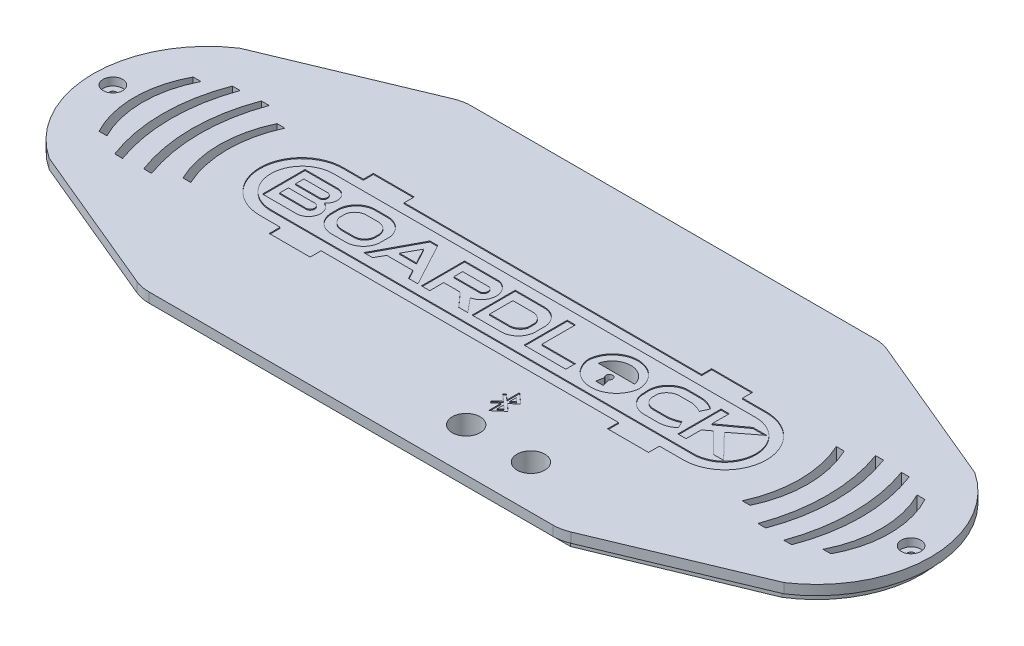
from build123d import *

# Parameters (mm, degrees)
BOSS_EXTRUDE3_DEPTH = 2.5
SKETCH2_8_R         = 3.55
BOSS_EXTRUDE4_DEPTH = 2.5
LOGO_DEPTH          = 0.25
FILLET1_R           = 10
SOUNDGAPS_REACH     = 178.856
BUTTONS_REACH       = 178.856
SKETCH5_R           = 3.55
CUT_EXTRUDE5_REACH  = 178.856
SKETCH9_R           = 2.5
CUT_EXTRUDE6_DEPTH  = 2
CUT_EXTRUDE7_REACH  = 178.856
SKETCH9_4_R         = 0.9
CUT_EXTRUDE8_DEPTH  = 0.25


with BuildPart() as part:
    # Sketch2 → Boss-Extrude3 (new body)
    with BuildSketch(Plane(origin=(0, 0, 0), x_dir=(1, 0, 0), z_dir=(0, 1, 0))):
        with BuildLine():
            Line((-2.5, 2.5), (104.5, 2.5))
            Line((104.5, 2.5), (144.737244829, -14.291091061))
            ThreePointArc((144.737244829, -14.291091061), (157.8, -38.6), (144.737244829, -62.908908939))
            Line((144.737244829, -62.908908939), (104.5, -79.7))
            Line((104.5, -79.7), (-2.5, -79.7))
            Line((-2.5, -79.7), (-42.737244829, -62.908908939))
            ThreePointArc((-42.737244829, -62.908908939), (-55.8, -38.6), (-42.737244829, -14.291091061))
            Line((-42.737244829, -14.291091061), (-2.5, 2.5))
        make_face()
    extrude(amount=BOSS_EXTRUDE3_DEPTH)

    # Sketch2<8> → Boss-Extrude4 (add)
    with BuildSketch(Plane(origin=(0, 0, 0), x_dir=(1, 0, 0), z_dir=(0, 1, 0))):
        with BuildLine():
            Line((102, 0), (0, 0))
            Line((0, 0), (-2.5, 0))
            Line((-2.5, 0), (-40.702591635, -15.743739118))
            ThreePointArc((-40.702591635, -15.743739118), (-53.480653983, -38.6), (-40.702591635, -61.456260882))
            Line((-40.702591635, -61.456260882), (-2.5, -77.2))
            Line((-2.5, -77.2), (0, -77.2))
            Line((0, -77.2), (102, -77.2))
            Line((102, -77.2), (104.5, -77.2))
            Line((104.5, -77.2), (142.702591635, -61.456260882))
            ThreePointArc((142.702591635, -61.456260882), (155.480653983, -38.6), (142.702591635, -15.743739118))
            Line((142.702591635, -15.743739118), (104.5, 0))
            Line((104.5, 0), (102, 0))
        make_face()
        with Locations((69.32, -68.6)):
            Circle(SKETCH2_8_R, mode=Mode.SUBTRACT)
        with Locations((85.83, -68.6)):
            Circle(SKETCH2_8_R, mode=Mode.SUBTRACT)
    extrude(amount=-BOSS_EXTRUDE4_DEPTH)

    # Sketch3 → Logo (cut)
    # profile 1 of 10: a face of its own
    with BuildSketch(Plane(origin=(0, 2.5, 0), x_dir=(1, 0, 0), z_dir=(0, 1, 0))):
        with BuildLine():
            Line((1.949493887, -27.461955416), (-2.987330566, -27.461955416))
            ThreePointArc((-2.987330566, -27.461955416), (-13.803120325, -38.068295938), (-2.987330566, -48.674636459))
            Line((-2.987330566, -48.674636459), (1.949493887, -48.674636459))
            Line((1.949493887, -48.674636459), (1.949493887, -51.464582861))
            Line((1.949493887, -51.464582861), (12.371678844, -51.464582861))
            Line((12.371678844, -51.464582861), (12.371678844, -48.674636459))
            Line((12.371678844, -48.674636459), (88.239814758, -48.674636459))
            Line((88.239814758, -48.674636459), (88.239814758, -51.464582861))
            Line((88.239814758, -51.464582861), (98.688646078, -51.464582861))
            Line((98.688646078, -51.464582861), (98.688646078, -48.674636459))
            Line((98.688646078, -48.674636459), (104.624475689, -48.674636459))
            ThreePointArc((104.624475689, -48.674636459), (115.383426883, -38.068295938), (104.624475689, -27.461955416))
            Line((104.624475689, -27.461955416), (98.688646078, -27.461955416))
            Line((98.688646078, -27.461955416), (98.688646078, -24.902120515))
            Line((98.688646078, -24.902120515), (88.239814758, -24.902120515))
            Line((88.239814758, -24.902120515), (88.239814758, -27.461955416))
            Line((88.239814758, -27.461955416), (12.371678844, -27.461955416))
            Line((12.371678844, -27.461955416), (12.371678844, -24.902120515))
            Line((12.371678844, -24.902120515), (1.949493887, -24.902120515))
            Line((1.949493887, -24.902120515), (1.949493887, -27.461955416))
        make_face()
        with BuildLine():
            ThreePointArc((-3.194751797, -46.01575407), (-11.064312283, -37.938772353), (-2.987330566, -30.069211866))
            Line((-2.987330566, -30.069211866), (104.700239847, -30.069211866))
            ThreePointArc((104.700239847, -30.069211866), (112.673510949, -38.042482968), (104.700239847, -46.01575407))
            Line((104.700239847, -46.01575407), (-3.194751797, -46.01575407))
        make_face(mode=Mode.SUBTRACT)
    # profile 2 of 10: a face of its own
    with BuildSketch(Plane(origin=(0, 2.5, 0), x_dir=(1, 0, 0), z_dir=(0, 1, 0))):
        with BuildLine():
            Line((0.713326147, -32.762452382), (-7.630609586, -32.762452382))
            Line((-7.630609586, -32.762452382), (-7.630609586, -43.623173078))
            Line((-7.630609586, -43.623173078), (1.144127176, -43.623173078))
            ThreePointArc((1.144127176, -43.623173078), (4.072531045, -41.089719603), (2.23246662, -37.682653616))
            ThreePointArc((2.23246662, -37.682653616), (3.210405226, -34.686087135), (0.713326147, -32.762452382))
        make_face()
        with BuildLine():
            Line((-5.680668083, -41.17440933), (-5.680668083, -38.952382967))
            Line((-5.680668083, -38.952382967), (0.713326147, -38.952382967))
            ThreePointArc((0.713326147, -38.952382967), (2.127219592, -40.063396149), (0.713326147, -41.17440933))
            Line((0.713326147, -41.17440933), (-5.680668083, -41.17440933))
        make_face(mode=Mode.SUBTRACT)
        with BuildLine():
            Line((-5.680668083, -37.138483894), (-5.680668083, -35.007152484))
            Line((-5.680668083, -35.007152484), (0.600049584, -35.007152484))
            ThreePointArc((0.600049584, -35.007152484), (1.408506175, -36.072818189), (0.600049584, -37.138483894))
            Line((0.600049584, -37.138483894), (-5.680668083, -37.138483894))
        make_face(mode=Mode.SUBTRACT)
    # profile 3 of 10: a face of its own
    with BuildSketch(Plane(origin=(0, 2.5, 0), x_dir=(1, 0, 0), z_dir=(0, 1, 0))):
        with BuildLine():
            Line((5.346460441, -36.917426319), (5.346460441, -39.213930644))
            ThreePointArc((5.346460441, -39.213930644), (6.885943052, -42.434479638), (10.251793679, -43.623173078))
            Line((10.251793679, -43.623173078), (13.828264636, -43.623173078))
            ThreePointArc((13.828264636, -43.623173078), (16.716995574, -42.386317426), (18.096652452, -39.562999301))
            Line((18.096652452, -39.562999301), (18.096652452, -36.788822077))
            ThreePointArc((18.096652452, -36.788822077), (16.446939465, -33.787674903), (13.228063284, -32.618370223))
            Line((13.228063284, -32.618370223), (9.865980952, -32.618370223))
            ThreePointArc((9.865980952, -32.618370223), (6.816585637, -33.937769105), (5.346460441, -36.917426319))
        make_face()
        with BuildLine():
            ThreePointArc((7.340408181, -37.428569745), (8.31320862, -35.726361526), (10.137103318, -35.007152484))
            Line((10.137103318, -35.007152484), (13.346680486, -35.007152484))
            ThreePointArc((13.346680486, -35.007152484), (15.178018472, -35.715584435), (16.137891368, -37.428569745))
            Line((16.137891368, -37.428569745), (16.137891368, -38.787399969))
            ThreePointArc((16.137891368, -38.787399969), (15.339335986, -40.518029243), (13.608745934, -41.316669621))
            Line((13.608745934, -41.316669621), (10.291673968, -41.316669621))
            ThreePointArc((10.291673968, -41.316669621), (8.405132361, -40.657148151), (7.340408181, -38.965885242))
            Line((7.340408181, -38.965885242), (7.340408181, -37.428569745))
        make_face(mode=Mode.SUBTRACT)
    # profile 4 of 10: a face of its own
    with BuildSketch(Plane(origin=(0, 2.5, 0), x_dir=(1, 0, 0), z_dir=(0, 1, 0))):
        Polygon((24.087565187, -32.618370223), (18.222944768, -43.623173078), (20.462903956, -43.623173078), (21.766152938, -41.316669621), (28.404577439, -41.316669621), (29.646736625, -43.623173078), (32.02923867, -43.623173078), (26.102641459, -32.618370223), align=None)
        Polygon((27.243871315, -39.213930644), (22.906495797, -39.213930644), (25.095103323, -35.2239905), align=None, mode=Mode.SUBTRACT)
    # profile 5 of 10: a face of its own
    with BuildSketch(Plane(origin=(0, 2.5, 0), x_dir=(1, 0, 0), z_dir=(0, 1, 0))):
        with BuildLine():
            Line((41.793638287, -32.618370223), (32.928013354, -32.618370223))
            Line((32.928013354, -32.618370223), (32.928013354, -43.623173078))
            Line((32.928013354, -43.623173078), (35.04301538, -43.623173078))
            Line((35.04301538, -43.623173078), (35.04301538, -40.063396149))
            Line((35.04301538, -40.063396149), (39.244046803, -40.063396149))
            Line((39.244046803, -40.063396149), (42.431036158, -43.623173078))
            Line((42.431036158, -43.623173078), (44.737782461, -43.623173078))
            Line((44.737782461, -43.623173078), (41.793638287, -40.063396149))
            ThreePointArc((41.793638287, -40.063396149), (44.733866299, -36.340883186), (41.793638287, -32.618370223))
        make_face()
        with BuildLine():
            Line((35.04301538, -37.48051524), (35.04301538, -35.2239905))
            Line((35.04301538, -35.2239905), (41.793638287, -35.2239905))
            ThreePointArc((41.793638287, -35.2239905), (42.65693054, -36.35225287), (41.793638287, -37.48051524))
            Line((41.793638287, -37.48051524), (35.04301538, -37.48051524))
        make_face(mode=Mode.SUBTRACT)
    # profile 6 of 10: a face of its own
    with BuildSketch(Plane(origin=(0, 2.5, 0), x_dir=(1, 0, 0), z_dir=(0, 1, 0))):
        with BuildLine():
            Line((52.968722487, -32.618370223), (45.846335848, -32.618370223))
            Line((45.846335848, -32.618370223), (45.846335848, -43.623173078))
            Line((45.846335848, -43.623173078), (52.83287315, -43.623173078))
            ThreePointArc((52.83287315, -43.623173078), (56.080236632, -42.589880341), (57.64582107, -39.562999301))
            Line((57.64582107, -39.562999301), (57.64582107, -36.788822077))
            ThreePointArc((57.64582107, -36.788822077), (56.171000638, -33.734937317), (52.968722487, -32.618370223))
        make_face()
        with BuildLine():
            Line((47.864668846, -41.17440933), (47.864668846, -35.2239905))
            Line((47.864668846, -35.2239905), (52.599988574, -35.2239905))
            ThreePointArc((52.599988574, -35.2239905), (54.440160348, -35.663250015), (55.624586826, -37.138483894))
            Line((55.624586826, -37.138483894), (55.624586826, -39.18661223))
            ThreePointArc((55.624586826, -39.18661223), (54.462155657, -40.712863912), (52.599988574, -41.17440933))
            Line((52.599988574, -41.17440933), (47.864668846, -41.17440933))
        make_face(mode=Mode.SUBTRACT)
    # profile 7 of 10: a face of its own
    with BuildSketch(Plane(origin=(0, 2.5, 0), x_dir=(1, 0, 0), z_dir=(0, 1, 0))):
        Polygon((61.195413218, -32.618370223), (59.109629375, -32.618370223), (59.109629375, -43.623173078), (69.752475136, -43.623173078), (69.752475136, -41.187576484), (61.195413218, -41.187576484), align=None)
    # profile 8 of 10: a face of its own
    with BuildSketch(Plane(origin=(0, 2.5, 0), x_dir=(1, 0, 0), z_dir=(0, 1, 0))):
        with BuildLine():
            ThreePointArc((86.967057925, -37.33302991), (88.24698918, -35.587564651), (90.332173753, -35.007152484))
            Line((90.332173753, -35.007152484), (93.354874286, -35.007152484))
            ThreePointArc((93.354874286, -35.007152484), (94.768458464, -35.327728442), (96.082389221, -35.939753883))
            Line((96.082389221, -35.939753883), (96.979753441, -33.956106658))
            ThreePointArc((96.979753441, -33.956106658), (95.096667996, -32.952004021), (92.988844144, -32.618370223))
            Line((92.988844144, -32.618370223), (89.529268924, -32.618370223))
            ThreePointArc((89.529268924, -32.618370223), (85.927201794, -34.605805074), (84.941711164, -38.6))
            Line((84.941711164, -38.6), (84.941711164, -39.513929713))
            ThreePointArc((84.941711164, -39.513929713), (86.739352365, -42.572399213), (90.127806859, -43.623173078))
            Line((90.127806859, -43.623173078), (93.049792527, -43.623173078))
            ThreePointArc((93.049792527, -43.623173078), (95.178031827, -43.279186153), (97.039888867, -42.192347671))
            Line((97.039888867, -42.192347671), (96.15967403, -40.380436784))
            ThreePointArc((96.15967403, -40.380436784), (94.749505142, -40.914672607), (93.266431414, -41.187576484))
            Line((93.266431414, -41.187576484), (89.766541153, -41.187576484))
            ThreePointArc((89.766541153, -41.187576484), (87.98359415, -40.626914615), (86.967057925, -39.058509102))
            Line((86.967057925, -39.058509102), (86.967057925, -37.33302991))
        make_face()
    # profile 9 of 10: a face of its own
    with BuildSketch(Plane(origin=(0, 2.5, 0), x_dir=(1, 0, 0), z_dir=(0, 1, 0))):
        Polygon((100.433477861, -32.619456407), (98.346127272, -32.619456407), (98.346127272, -43.625930338), (100.433477861, -43.625930338), (100.433477861, -39.738654566), (102.223113581, -38.43184366), (107.375394287, -43.625930338), (110.007271118, -43.625930338), (103.904039503, -37.33302991), (110.007271118, -32.619456407), (106.490539146, -32.619456407), (100.433477861, -37.042386537), align=None)
    # profile 10 of 10: a face of its own
    with BuildSketch(Plane(origin=(0, 2.5, 0), x_dir=(1, 0, 0), z_dir=(0, 1, 0))):
        with BuildLine():
            ThreePointArc((83.440446503, -38.6), (76.914090873, -32.366505687), (70.387735243, -38.6))
            ThreePointArc((70.387735243, -38.6), (76.914090873, -44.419626268), (83.440446503, -38.6))
        make_face()
        with BuildLine():
            Line((75.957169691, -42.192347671), (76.285044547, -40.252788166))
            ThreePointArc((76.285044547, -40.252788166), (76.809249819, -38.728957059), (77.33345509, -40.252788166))
            Line((77.33345509, -40.252788166), (77.846095102, -42.192347671))
            Line((77.846095102, -42.192347671), (75.957169691, -42.192347671))
        make_face(mode=Mode.SUBTRACT)
        with BuildLine():
            Line((81.605728053, -37.905608877), (72.327294748, -37.905608877))
            ThreePointArc((72.327294748, -37.905608877), (76.9665114, -34.227223026), (81.605728053, -37.905608877))
        make_face(mode=Mode.SUBTRACT)
    extrude(amount=-LOGO_DEPTH, mode=Mode.SUBTRACT)

    # Fillet1
    fillet1_edges = [part.edges().sort_by_distance(p)[0] for p in [
        (-2.5, 1.25, -2.5),
        (104.5, 1.25, -2.5),
        (104.5, 1.25, 79.7),
        (-2.5, 1.25, 79.7),
    ]]
    fillet(fillet1_edges, radius=FILLET1_R)

    # Sketch4 → SoundGaps (cut, up to next)
    with BuildSketch(Plane(origin=(0, 2.5, 0), x_dir=(1, 0, 0), z_dir=(0, 1, 0)), mode=Mode.PRIVATE) as soundgaps_sk1:
        with BuildLine():
            Line((-42.336442958, -26.6), (-40.336442958, -26.6))
            ThreePointArc((-40.336442958, -26.6), (-43.210098634, -38.6), (-40.336442958, -50.6))
            Line((-40.336442958, -50.6), (-42.336442958, -50.6))
            ThreePointArc((-42.336442958, -50.6), (-45.345121926, -38.6), (-42.336442958, -26.6))
        make_face()
    soundgaps_tool1 = extrude(soundgaps_sk1.sketch, amount=-SOUNDGAPS_REACH, mode=Mode.PRIVATE) & part.part
    # Sketch4 → SoundGaps (cut, up to next)
    with BuildSketch(Plane(origin=(0, 2.5, 0), x_dir=(1, 0, 0), z_dir=(0, 1, 0)), mode=Mode.PRIVATE) as soundgaps_sk2:
        with BuildLine():
            Line((-35.336442958, -53.6), (-33.336442958, -53.6))
            ThreePointArc((-33.336442958, -53.6), (-35.959167646, -38.6), (-33.336442958, -23.6))
            Line((-33.336442958, -23.6), (-35.336442958, -23.6))
            ThreePointArc((-35.336442958, -23.6), (-38.112185635, -38.6), (-35.336442958, -53.6))
        make_face()
    soundgaps_tool2 = extrude(soundgaps_sk2.sketch, amount=-SOUNDGAPS_REACH, mode=Mode.PRIVATE) & part.part
    # Sketch4 → SoundGaps (cut, up to next)
    with BuildSketch(Plane(origin=(0, 2.5, 0), x_dir=(1, 0, 0), z_dir=(0, 1, 0)), mode=Mode.PRIVATE) as soundgaps_sk3:
        with BuildLine():
            Line((-28.336442958, -23.2), (-26.336442958, -23.2))
            ThreePointArc((-26.336442958, -23.2), (-28.980435332, -38.2), (-26.336442958, -53.2))
            Line((-26.336442958, -53.2), (-28.336442958, -53.2))
            ThreePointArc((-28.336442958, -53.2), (-31.075866522, -38.2), (-28.336442958, -23.2))
        make_face()
    soundgaps_tool3 = extrude(soundgaps_sk3.sketch, amount=-SOUNDGAPS_REACH, mode=Mode.PRIVATE) & part.part
    # Sketch4 → SoundGaps (cut, up to next)
    with BuildSketch(Plane(origin=(0, 2.5, 0), x_dir=(1, 0, 0), z_dir=(0, 1, 0)), mode=Mode.PRIVATE) as soundgaps_sk4:
        with BuildLine():
            Line((-21.336442958, -50.2), (-19.336442958, -50.2))
            ThreePointArc((-19.336442958, -50.2), (-21.944289857, -38.2), (-19.336442958, -26.2))
            Line((-19.336442958, -26.2), (-21.336442958, -26.2))
            ThreePointArc((-21.336442958, -26.2), (-24.039371453, -38.2), (-21.336442958, -50.2))
        make_face()
    soundgaps_tool4 = extrude(soundgaps_sk4.sketch, amount=-SOUNDGAPS_REACH, mode=Mode.PRIVATE) & part.part
    # Sketch4 → SoundGaps (cut, up to next)
    with BuildSketch(Plane(origin=(0, 2.5, 0), x_dir=(1, 0, 0), z_dir=(0, 1, 0)), mode=Mode.PRIVATE) as soundgaps_sk5:
        with BuildLine():
            Line((123.336442958, -26.2), (121.336442958, -26.2))
            ThreePointArc((121.336442958, -26.2), (123.944289857, -38.2), (121.336442958, -50.2))
            Line((121.336442958, -50.2), (123.336442958, -50.2))
            ThreePointArc((123.336442958, -50.2), (126.039371453, -38.2), (123.336442958, -26.2))
        make_face()
    soundgaps_tool5 = extrude(soundgaps_sk5.sketch, amount=-SOUNDGAPS_REACH, mode=Mode.PRIVATE) & part.part
    # Sketch4 → SoundGaps (cut, up to next)
    with BuildSketch(Plane(origin=(0, 2.5, 0), x_dir=(1, 0, 0), z_dir=(0, 1, 0)), mode=Mode.PRIVATE) as soundgaps_sk6:
        with BuildLine():
            Line((130.336442958, -53.2), (128.336442958, -53.2))
            ThreePointArc((128.336442958, -53.2), (130.980435332, -38.2), (128.336442958, -23.2))
            Line((128.336442958, -23.2), (130.336442958, -23.2))
            ThreePointArc((130.336442958, -23.2), (133.075866522, -38.2), (130.336442958, -53.2))
        make_face()
    soundgaps_tool6 = extrude(soundgaps_sk6.sketch, amount=-SOUNDGAPS_REACH, mode=Mode.PRIVATE) & part.part
    # Sketch4 → SoundGaps (cut, up to next)
    with BuildSketch(Plane(origin=(0, 2.5, 0), x_dir=(1, 0, 0), z_dir=(0, 1, 0)), mode=Mode.PRIVATE) as soundgaps_sk7:
        with BuildLine():
            Line((137.336442958, -23.6), (135.336442958, -23.6))
            ThreePointArc((135.336442958, -23.6), (137.959167646, -38.6), (135.336442958, -53.6))
            Line((135.336442958, -53.6), (137.336442958, -53.6))
            ThreePointArc((137.336442958, -53.6), (140.112185635, -38.6), (137.336442958, -23.6))
        make_face()
    soundgaps_tool7 = extrude(soundgaps_sk7.sketch, amount=-SOUNDGAPS_REACH, mode=Mode.PRIVATE) & part.part
    # Sketch4 → SoundGaps (cut, up to next)
    with BuildSketch(Plane(origin=(0, 2.5, 0), x_dir=(1, 0, 0), z_dir=(0, 1, 0)), mode=Mode.PRIVATE) as soundgaps_sk8:
        with BuildLine():
            Line((144.336442958, -50.6), (142.336442958, -50.6))
            ThreePointArc((142.336442958, -50.6), (145.210098634, -38.6), (142.336442958, -26.6))
            Line((142.336442958, -26.6), (144.336442958, -26.6))
            ThreePointArc((144.336442958, -26.6), (147.345121926, -38.6), (144.336442958, -50.6))
        make_face()
    soundgaps_tool8 = extrude(soundgaps_sk8.sketch, amount=-SOUNDGAPS_REACH, mode=Mode.PRIVATE) & part.part
    add(soundgaps_tool1.solids().sort_by_distance((-43.336866, 2.5, 38.6))[0], mode=Mode.SUBTRACT)
    add(soundgaps_tool2.solids().sort_by_distance((-36.164676, 2.5, 38.6))[0], mode=Mode.SUBTRACT)
    add(soundgaps_tool3.solids().sort_by_distance((-29.153278, 2.5, 38.2))[0], mode=Mode.SUBTRACT)
    add(soundgaps_tool4.solids().sort_by_distance((-22.134482, 2.5, 38.2))[0], mode=Mode.SUBTRACT)
    add(soundgaps_tool5.solids().sort_by_distance((124.134482, 2.5, 38.2))[0], mode=Mode.SUBTRACT)
    add(soundgaps_tool6.solids().sort_by_distance((131.153278, 2.5, 38.2))[0], mode=Mode.SUBTRACT)
    add(soundgaps_tool7.solids().sort_by_distance((138.164676, 2.5, 38.6))[0], mode=Mode.SUBTRACT)
    add(soundgaps_tool8.solids().sort_by_distance((145.336866, 2.5, 38.6))[0], mode=Mode.SUBTRACT)

    # Sketch5 → Buttons (cut, up to next)
    with BuildSketch(Plane(origin=(0, 2.5, 0), x_dir=(1, 0, 0), z_dir=(0, 1, 0)), mode=Mode.PRIVATE) as buttons_sk1:
        with Locations((69.32, -68.6)):
            Circle(SKETCH5_R)
    buttons_tool1 = extrude(buttons_sk1.sketch, amount=-BUTTONS_REACH, mode=Mode.PRIVATE) & part.part
    # Sketch5 → Buttons (cut, up to next)
    with BuildSketch(Plane(origin=(0, 2.5, 0), x_dir=(1, 0, 0), z_dir=(0, 1, 0)), mode=Mode.PRIVATE) as buttons_sk2:
        with Locations((85.83, -68.6)):
            Circle(SKETCH5_R)
    buttons_tool2 = extrude(buttons_sk2.sketch, amount=-BUTTONS_REACH, mode=Mode.PRIVATE) & part.part
    add(buttons_tool1.solids().sort_by_distance((69.32, 2.5, 68.6))[0], mode=Mode.SUBTRACT)
    add(buttons_tool2.solids().sort_by_distance((85.83, 2.5, 68.6))[0], mode=Mode.SUBTRACT)

    # Sketch3<5> → Cut-Extrude5 (cut, up to next)
    with BuildSketch(Plane(origin=(0, 2.5, 0), x_dir=(1, 0, 0), z_dir=(0, 1, 0)), mode=Mode.PRIVATE) as cut_extrude5_sk1:
        with BuildLine():
            ThreePointArc((81.605728053, -37.905608877), (76.9665114, -34.227223026), (72.327294748, -37.905608877))
            Line((72.327294748, -37.905608877), (81.605728053, -37.905608877))
        make_face()
    cut_extrude5_tool1 = extrude(cut_extrude5_sk1.sketch, amount=-CUT_EXTRUDE5_REACH, mode=Mode.PRIVATE) & part.part
    # Sketch3<5> → Cut-Extrude5 (cut, up to next)
    with BuildSketch(Plane(origin=(0, 2.5, 0), x_dir=(1, 0, 0), z_dir=(0, 1, 0)), mode=Mode.PRIVATE) as cut_extrude5_sk2:
        with BuildLine():
            ThreePointArc((77.33345509, -40.252788166), (76.809249819, -38.728957059), (76.285044547, -40.252788166))
            Line((76.285044547, -40.252788166), (75.957169691, -42.192347671))
            Line((75.957169691, -42.192347671), (77.846095102, -42.192347671))
            Line((77.846095102, -42.192347671), (77.33345509, -40.252788166))
        make_face()
    cut_extrude5_tool2 = extrude(cut_extrude5_sk2.sketch, amount=-CUT_EXTRUDE5_REACH, mode=Mode.PRIVATE) & part.part
    add(cut_extrude5_tool1.solids().sort_by_distance((76.966511, 2.5, 36.371206))[0], mode=Mode.SUBTRACT)
    add(cut_extrude5_tool2.solids().sort_by_distance((76.838073, 2.5, 40.549632))[0], mode=Mode.SUBTRACT)

    # Sketch9 → Cut-Extrude6 (cut)
    with BuildSketch(Plane(origin=(0, 2.5, 0), x_dir=(1, 0, 0), z_dir=(0, 1, 0))):
        with Locations((-50.8, -38.6)):
            Circle(SKETCH9_R)
        with Locations((152.8, -38.6)):
            Circle(SKETCH9_R)
    extrude(amount=-CUT_EXTRUDE6_DEPTH, mode=Mode.SUBTRACT)

    # Sketch9<4> → Cut-Extrude7 (cut, up to next)
    with BuildSketch(Plane(origin=(0, 2.5, 0), x_dir=(1, 0, 0), z_dir=(0, 1, 0)), mode=Mode.PRIVATE) as cut_extrude7_sk1:
        with Locations((-50.8, -38.6)):
            Circle(SKETCH9_4_R)
    cut_extrude7_tool1 = extrude(cut_extrude7_sk1.sketch, amount=-CUT_EXTRUDE7_REACH, mode=Mode.PRIVATE) & part.part
    # Sketch9<4> → Cut-Extrude7 (cut, up to next)
    with BuildSketch(Plane(origin=(0, 2.5, 0), x_dir=(1, 0, 0), z_dir=(0, 1, 0)), mode=Mode.PRIVATE) as cut_extrude7_sk2:
        with Locations((152.8, -38.6)):
            Circle(SKETCH9_4_R)
    cut_extrude7_tool2 = extrude(cut_extrude7_sk2.sketch, amount=-CUT_EXTRUDE7_REACH, mode=Mode.PRIVATE) & part.part
    add(cut_extrude7_tool1.solids().sort_by_distance((-50.8, 2.5, 38.6))[0], mode=Mode.SUBTRACT)
    add(cut_extrude7_tool2.solids().sort_by_distance((152.8, 2.5, 38.6))[0], mode=Mode.SUBTRACT)

    # Sketch10 → Cut-Extrude8 (cut)
    with BuildSketch(Plane(origin=(0, 2.5, 0), x_dir=(1, 0, 0), z_dir=(0, 1, 0))):
        Polygon((69.023674328, -62.65258598), (69.043475632, -59.418544724), (67.619500709, -60.678940456), (67.168659507, -60.169587282), (68.893119444, -58.655144924), (67.136780756, -57.120147293), (67.619500709, -56.669510481), (69.028292542, -57.900760548), (69.028292542, -54.677474496), (71.699903201, -57.067274405), (69.887186883, -58.671754845), (71.715031338, -60.306791933), align=None)
        Polygon((69.723083878, -56.229524643), (69.723083878, -57.900760548), (70.667561895, -57.065142595), align=None, mode=Mode.SUBTRACT)
        Polygon((69.723083878, -59.452700656), (69.723083878, -61.130916865), (70.667561895, -60.295298913), align=None, mode=Mode.SUBTRACT)
    extrude(amount=-CUT_EXTRUDE8_DEPTH, mode=Mode.SUBTRACT)


solid = part.part
